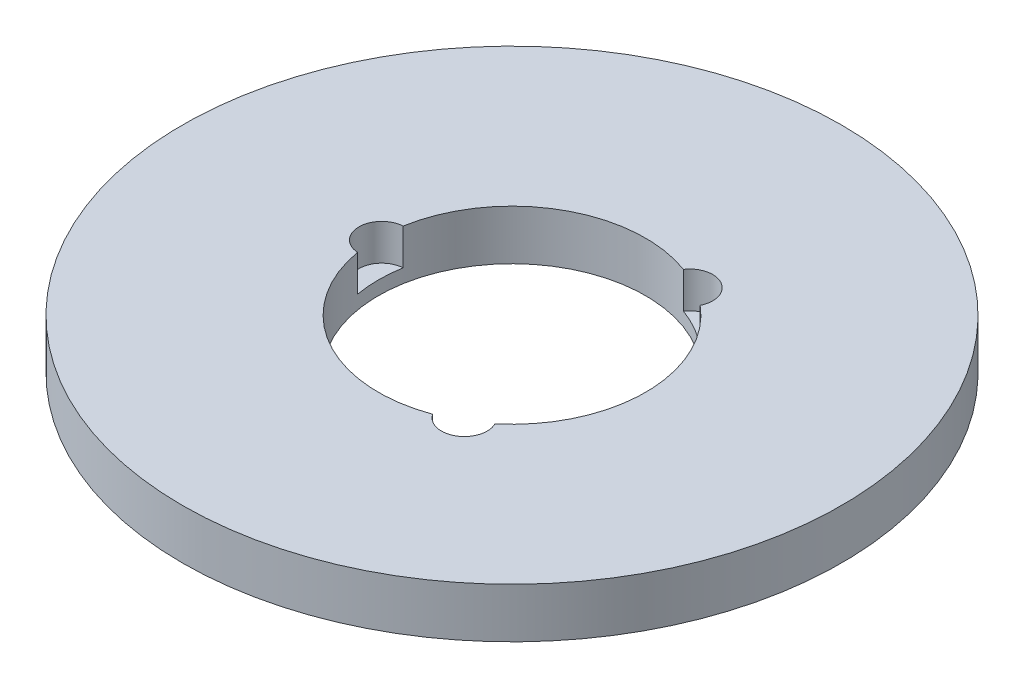
from build123d import *

# Parameters (mm, degrees)
SKETCH1_R           = 92.5
BOSS_EXTRUDE1_DEPTH = 14
SKETCH2_R           = 37.5
CUT_EXTRUDE1_DEPTH  = 132.561772563
SKETCH3_R           = 6.415344471
CUT_EXTRUDE2_DEPTH  = 10.158194545
CIRPATTERN1_COUNT   = 3


with BuildPart() as part:
    # Sketch1 → Boss-Extrude1 (new body)
    with BuildSketch(Plane(origin=(0, 0, 0), x_dir=(1, 0, 0), z_dir=(0, 1, 0))):
        Circle(SKETCH1_R)
    extrude(amount=BOSS_EXTRUDE1_DEPTH)

    # Sketch2 → Cut-Extrude1 (cut, through all)
    with BuildSketch(Plane(origin=(0, 0, 0), x_dir=(1, 0, 0), z_dir=(0, 1, 0))):
        Circle(SKETCH2_R)
    extrude(amount=CUT_EXTRUDE1_DEPTH, mode=Mode.SUBTRACT)

    # Sketch3 → Cut-Extrude2 (cut)
    with BuildSketch(Plane(origin=(0, 14, 0), x_dir=(1, 0, 0), z_dir=(0, 1, 0))):
        with Locations((-36.547441057, 0)):
            Circle(SKETCH3_R)
    cut_extrude2 = extrude(amount=-CUT_EXTRUDE2_DEPTH, mode=Mode.SUBTRACT)

    # CirPattern1: Cut-Extrude2 ×3 about axis
    cirpattern1_axis = Axis((0, 0, 0), (0, 1, 0))
    for i in range(1, CIRPATTERN1_COUNT):
        add(cut_extrude2.rotate(cirpattern1_axis, i * 360 / CIRPATTERN1_COUNT), mode=Mode.SUBTRACT)


solid = part.part
